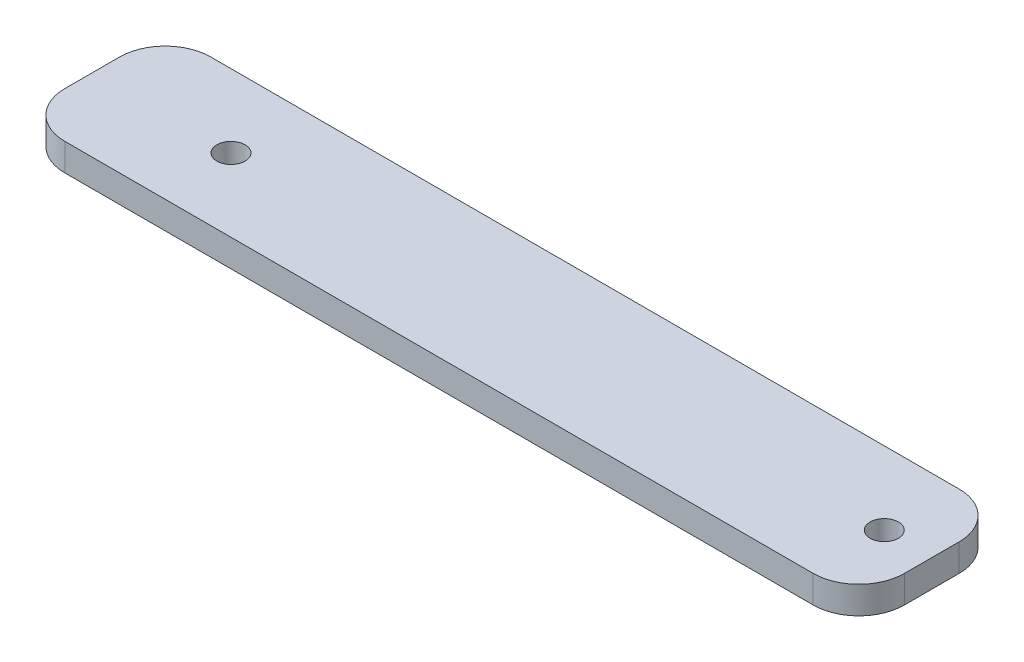
from build123d import *

# Parameters (mm, degrees)
SKETCH1_W           = 92
SKETCH1_H           = 16
SKETCH1_R           = 1.55
BOSS_EXTRUDE1_DEPTH = 3
FILLET1_R           = 5


with BuildPart() as part:
    # Sketch1 → Boss-Extrude1 (new body)
    with BuildSketch(Plane(origin=(0, 0, 0), x_dir=(1, 0, 0), z_dir=(0, 1, 0))):
        Rectangle(SKETCH1_W, SKETCH1_H)
        with Locations((40.79, 0)):
            Circle(SKETCH1_R, mode=Mode.SUBTRACT)
        with Locations((-30.79, 0)):
            Circle(SKETCH1_R, mode=Mode.SUBTRACT)
    extrude(amount=BOSS_EXTRUDE1_DEPTH)

    # Fillet1
    fillet1_edges = [part.edges().sort_by_distance(p)[0] for p in [
        (46, 1.5, -8),
        (-46, 1.5, -8),
        (-46, 1.5, 8),
        (46, 1.5, 8),
    ]]
    fillet(fillet1_edges, radius=FILLET1_R)


solid = part.part
